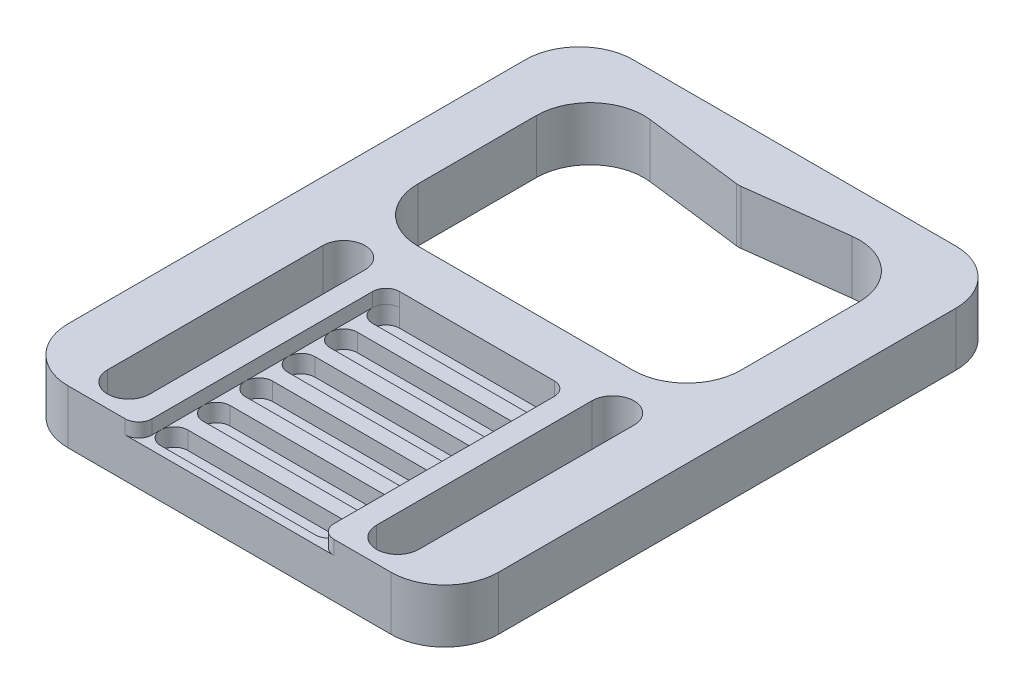
from build123d import *

# Parameters (mm, degrees)
SKETCH1_W           = 50.8
SKETCH1_H           = 66.675
BOSS_EXTRUDE1_DEPTH = 3.175
FILLET1_R           = 6.35
SKETCH3_W           = 21.450000026
SKETCH3_H           = 29.20000002
CUT_EXTRUDE2_DEPTH  = 1.650000002
CUT_EXTRUDE1_DEPTH  = 2.100000118
FILLET2_R           = 1.600000102


with BuildPart() as part:
    # Sketch1 → Boss-Extrude1 (new, symmetric)
    with BuildSketch(Plane(origin=(0, 0, 0), x_dir=(1, 0, 0), z_dir=(0, 1, 0))):
        with Locations((25.4, 33.3375)):
            Rectangle(SKETCH1_W, SKETCH1_H)
        with BuildLine():
            ThreePointArc((7.0358, 29.36875), (9.525, 31.85795), (12.0142, 29.36875))
            Line((12.0142, 29.36875), (12.0142, 3.96875))
            ThreePointArc((12.0142, 3.96875), (9.525, 1.47955), (7.0358, 3.96875))
            Line((7.0358, 3.96875), (7.0358, 29.36875))
        make_face(mode=Mode.SUBTRACT)
        with BuildLine():
            ThreePointArc((38.7858, 29.36875), (41.275, 31.85795), (43.7642, 29.36875))
            Line((43.7642, 29.36875), (43.7642, 3.96875))
            ThreePointArc((43.7642, 3.96875), (41.275, 1.47955), (38.7858, 3.96875))
            Line((38.7858, 3.96875), (38.7858, 29.36875))
        make_face(mode=Mode.SUBTRACT)
        with BuildLine():
            Line((6.35, 34.925), (6.35, 62.45225))
            Line((6.35, 62.45225), (25.151930523, 60.102008685))
            ThreePointArc((25.151930523, 60.102008685), (25.4, 60.086564438), (25.648069477, 60.102008685))
            Line((25.648069477, 60.102008685), (44.45, 62.45225))
            Line((44.45, 62.45225), (44.45, 34.925))
            Line((44.45, 34.925), (6.35, 34.925))
        make_face(mode=Mode.SUBTRACT)
    extrude(amount=BOSS_EXTRUDE1_DEPTH, both=True)

    # Fillet1
    fillet1_edges = [part.edges().sort_by_distance(p)[0] for p in [
        (6.35, 0, -62.45225),
        (6.35, 0, -34.925),
        (44.45, 0, -34.925),
        (44.45, 0, -62.45225),
        (0, 0, 0),
        (0, 0, -66.675),
        (50.8, 0, -66.675),
        (50.8, 0, 0),
    ]]
    fillet(fillet1_edges, radius=FILLET1_R)

    # Sketch3 → Cut-Extrude2 (cut)
    with BuildSketch(Plane(origin=(0, 3.175, 0), x_dir=(1, 0, 0), z_dir=(0, 1, 0))):
        with Locations((25.4, 14.60000001)):
            Rectangle(SKETCH3_W, SKETCH3_H)
    extrude(amount=-CUT_EXTRUDE2_DEPTH, mode=Mode.SUBTRACT)

    # Sketch2 → Cut-Extrude1 (cut)
    with BuildSketch(Plane(origin=(0, 1.524999998, 0), x_dir=(1, 0, 0), z_dir=(0, 1, 0))):
        with BuildLine():
            Line((16.274999962, 4.199999982), (34.525000038, 4.199999982))
            ThreePointArc((34.525000038, 4.199999982), (36.125000013, 2.600000007), (34.525000038, 1.000000032))
            Line((34.525000038, 1.000000032), (16.274999962, 1.000000032))
            ThreePointArc((16.274999962, 1.000000032), (14.674999987, 2.600000007), (16.274999962, 4.199999982))
        make_face()
        with BuildLine():
            Line((16.274999962, 29.199999512), (34.525000038, 29.199999512))
            ThreePointArc((34.525000038, 29.199999512), (36.125000013, 27.599999537), (34.525000038, 25.999999562))
            Line((34.525000038, 25.999999562), (16.274999962, 25.999999562))
            ThreePointArc((16.274999962, 25.999999562), (14.674999987, 27.599999537), (16.274999962, 29.199999512))
        make_face()
        with BuildLine():
            Line((16.274999962, 9.199999888), (34.525000038, 9.199999888))
            ThreePointArc((34.525000038, 9.199999888), (36.125000013, 7.599999913), (34.525000038, 5.999999938))
            Line((34.525000038, 5.999999938), (16.274999962, 5.999999938))
            ThreePointArc((16.274999962, 5.999999938), (14.674999987, 7.599999913), (16.274999962, 9.199999888))
        make_face()
        with BuildLine():
            Line((16.274999962, 14.199999794), (34.525000038, 14.199999794))
            ThreePointArc((34.525000038, 14.199999794), (36.125000013, 12.599999819), (34.525000038, 10.999999844))
            Line((34.525000038, 10.999999844), (16.274999962, 10.999999844))
            ThreePointArc((16.274999962, 10.999999844), (14.674999987, 12.599999819), (16.274999962, 14.199999794))
        make_face()
        with BuildLine():
            Line((16.274999962, 19.1999997), (34.525000038, 19.1999997))
            ThreePointArc((34.525000038, 19.1999997), (36.125000013, 17.599999725), (34.525000038, 15.99999975))
            Line((34.525000038, 15.99999975), (16.274999962, 15.99999975))
            ThreePointArc((16.274999962, 15.99999975), (14.674999987, 17.599999725), (16.274999962, 19.1999997))
        make_face()
        with BuildLine():
            Line((16.274999962, 24.199999606), (34.525000038, 24.199999606))
            ThreePointArc((34.525000038, 24.199999606), (36.125000013, 22.599999631), (34.525000038, 20.999999656))
            Line((34.525000038, 20.999999656), (16.274999962, 20.999999656))
            ThreePointArc((16.274999962, 20.999999656), (14.674999987, 22.599999631), (16.274999962, 24.199999606))
        make_face()
    extrude(amount=-CUT_EXTRUDE1_DEPTH, mode=Mode.SUBTRACT)

    # Fillet2
    fillet2_edges = [part.edges().sort_by_distance(p)[0] for p in [
        (36.125000013, 2.349999999, -29.20000002),
        (14.674999987, 2.349999999, -29.20000002),
    ]]
    fillet(fillet2_edges, radius=FILLET2_R - 0.0001)  # a hair under: the kernel refuses the full size
    fillet2_2_edges = [part.edges().sort_by_distance(p)[0] for p in [
        (36.125000013, 2.349999999, 0),
        (14.674999987, 2.349999999, 0),
    ]]
    fillet(fillet2_2_edges, radius=FILLET2_R)


solid = part.part
